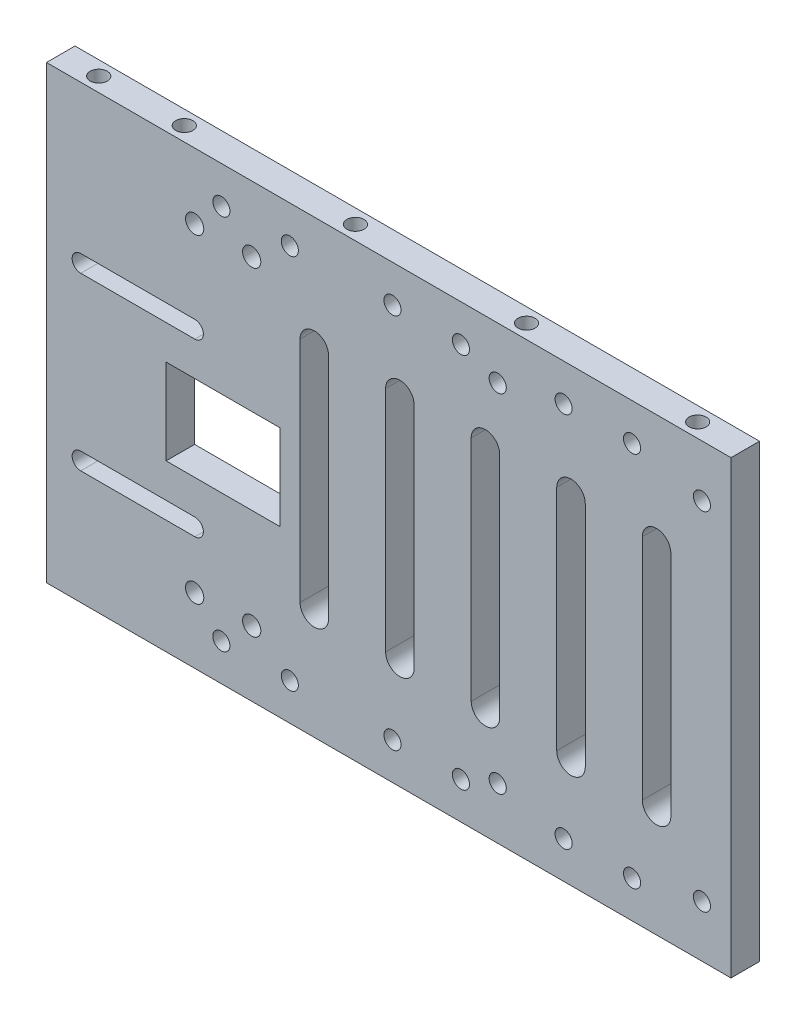
from build123d import *

# Parameters (mm, degrees)
SKETCH_1_W               = 120
SKETCH_1_H               = 79
EXTRUDE_1_DEPTH          = 5
SKETCH_2_R               = 3.1
CUT_EXTRUDE_1_DEPTH      = 2
SKETCH_3_R               = 1.5
CUT_EXTRUDE_2_DEPTH      = 72.897496479
PATTERN_LINEAR_1_COUNT   = 3
PATTERN_LINEAR_1_PITCH   = 30
MIRROR_2_COPY_1_SKETCH_R = 3.1
MIRROR_2_COPY_1_DEPTH    = 2
MIRROR_2_COPY_2_SKETCH_R = 3.1
MIRROR_2_COPY_2_DEPTH    = 2
MIRROR_2_COPY_3_SKETCH_R = 1.5
MIRROR_2_COPY_3_DEPTH    = 72.897496479
MIRROR_2_COPY_4_SKETCH_R = 1.5
MIRROR_2_COPY_4_DEPTH    = 72.897496479
MIRROR_2_COPY_5_SKETCH_R = 3.1
MIRROR_2_COPY_5_DEPTH    = 2
MIRROR_2_COPY_6_SKETCH_R = 1.5
MIRROR_2_COPY_6_DEPTH    = 72.897496479
CUT_EXTRUDE_3_DEPTH      = 1.5
CUT_EXTRUDE_4_DEPTH      = 72.920094549
SKETCH_7_R               = 1.5
CUT_EXTRUDE_6_DEPTH      = 5
SKETCH_9_R               = 1.6
SKETCH_9_R_2             = 1.5
CUT_EXTRUDE_7_DEPTH      = 73.008680032
SKETCH_11_W              = 20
SKETCH_11_H              = 15
CUT_EXTRUDE_8_DEPTH      = 73.008680032


with BuildPart() as part:
    # 草图1 → 凸台-拉伸1 (new body)
    with BuildSketch(Plane.XY):
        Rectangle(SKETCH_1_W, SKETCH_1_H)
    extrude(amount=EXTRUDE_1_DEPTH)

    # 草图2 → 切除-拉伸1 (cut)
    with BuildSketch(Plane(origin=(0, 0, 0), x_dir=(-1, 0, 0), z_dir=(0, 0, -1))):
        with Locations((-42.655984764, -33)):
            Circle(SKETCH_2_R)
        with Locations((-30.655984764, -33)):
            Circle(SKETCH_2_R)
    cut_extrude_1 = extrude(amount=-CUT_EXTRUDE_1_DEPTH, mode=Mode.SUBTRACT)

    # 草图3 → 切除-拉伸2 (cut, through all)
    with BuildSketch(Plane(origin=(0, 0, 2), x_dir=(-1, 0, 0), z_dir=(0, 0, -1))):
        with Locations((-42.655984764, -33)):
            Circle(SKETCH_3_R)
        with Locations((-30.655984764, -33)):
            Circle(SKETCH_3_R)
    cut_extrude_2 = extrude(amount=-CUT_EXTRUDE_2_DEPTH, mode=Mode.SUBTRACT)

    # 阵列(线性)1: 切除-拉伸1, 切除-拉伸2 ×3
    with Locations(*[(-i * PATTERN_LINEAR_1_PITCH, 0, 0) for i in range(1, PATTERN_LINEAR_1_COUNT)]):
        add(cut_extrude_1, mode=Mode.SUBTRACT)
        add(cut_extrude_2, mode=Mode.SUBTRACT)

    # 镜向2 copy 1 sketch → 镜向2 copy 1 (cut)
    with BuildSketch(Plane(origin=(-30, 0, 0), x_dir=(-1, 0, 0), z_dir=(0, 0, -1))):
        with Locations((-42.655984764, 33)):
            Circle(MIRROR_2_COPY_1_SKETCH_R)
        with Locations((-30.655984764, 33)):
            Circle(MIRROR_2_COPY_1_SKETCH_R)
    extrude(amount=-MIRROR_2_COPY_1_DEPTH, mode=Mode.SUBTRACT)

    # 镜向2 copy 2 sketch → 镜向2 copy 2 (cut)
    with BuildSketch(Plane(origin=(-60, 0, 0), x_dir=(-1, 0, 0), z_dir=(0, 0, -1))):
        with Locations((-42.655984764, 33)):
            Circle(MIRROR_2_COPY_2_SKETCH_R)
        with Locations((-30.655984764, 33)):
            Circle(MIRROR_2_COPY_2_SKETCH_R)
    extrude(amount=-MIRROR_2_COPY_2_DEPTH, mode=Mode.SUBTRACT)

    # 镜向2 copy 3 sketch → 镜向2 copy 3 (cut, through all)
    with BuildSketch(Plane(origin=(-30, 0, 2), x_dir=(-1, 0, 0), z_dir=(0, 0, -1))):
        with Locations((-42.655984764, 33)):
            Circle(MIRROR_2_COPY_3_SKETCH_R)
        with Locations((-30.655984764, 33)):
            Circle(MIRROR_2_COPY_3_SKETCH_R)
    extrude(amount=-MIRROR_2_COPY_3_DEPTH, mode=Mode.SUBTRACT)

    # 镜向2 copy 4 sketch → 镜向2 copy 4 (cut, through all)
    with BuildSketch(Plane(origin=(-60, 0, 2), x_dir=(-1, 0, 0), z_dir=(0, 0, -1))):
        with Locations((-42.655984764, 33)):
            Circle(MIRROR_2_COPY_4_SKETCH_R)
        with Locations((-30.655984764, 33)):
            Circle(MIRROR_2_COPY_4_SKETCH_R)
    extrude(amount=-MIRROR_2_COPY_4_DEPTH, mode=Mode.SUBTRACT)

    # 镜向2 copy 5 sketch → 镜向2 copy 5 (cut)
    with BuildSketch(Plane(origin=(0, 0, 0), x_dir=(-1, 0, 0), z_dir=(0, 0, -1))):
        with Locations((-42.655984764, 33)):
            Circle(MIRROR_2_COPY_5_SKETCH_R)
        with Locations((-30.655984764, 33)):
            Circle(MIRROR_2_COPY_5_SKETCH_R)
    extrude(amount=-MIRROR_2_COPY_5_DEPTH, mode=Mode.SUBTRACT)

    # 镜向2 copy 6 sketch → 镜向2 copy 6 (cut, through all)
    with BuildSketch(Plane(origin=(0, 0, 2), x_dir=(-1, 0, 0), z_dir=(0, 0, -1))):
        with Locations((-42.655984764, 33)):
            Circle(MIRROR_2_COPY_6_SKETCH_R)
        with Locations((-30.655984764, 33)):
            Circle(MIRROR_2_COPY_6_SKETCH_R)
    extrude(amount=-MIRROR_2_COPY_6_DEPTH, mode=Mode.SUBTRACT)

    # 草图4 → 切除-拉伸3 (cut)
    with BuildSketch(Plane(origin=(0, 0, 0), x_dir=(-1, 0, 0), z_dir=(0, 0, -1))):
        with BuildLine():
            Line((34, 15.1), (54, 15.1))
            ThreePointArc((54, 15.1), (57.1, 12), (54, 8.9))
            Line((54, 8.9), (34, 8.9))
            ThreePointArc((34, 8.9), (30.9, 12), (34, 15.1))
        make_face()
        with BuildLine():
            Line((34, -21.1), (54, -21.1))
            ThreePointArc((54, -21.1), (57.1, -18), (54, -14.9))
            Line((54, -14.9), (34, -14.9))
            ThreePointArc((34, -14.9), (30.9, -18), (34, -21.1))
        make_face()
    extrude(amount=-CUT_EXTRUDE_3_DEPTH, mode=Mode.SUBTRACT)

    # 草图5 → 切除-拉伸4 (cut, through all)
    with BuildSketch(Plane(origin=(0, 0, 1.5), x_dir=(-1, 0, 0), z_dir=(0, 0, -1))):
        with BuildLine():
            Line((54, 10.5), (34, 10.5))
            ThreePointArc((34, 10.5), (32.5, 12), (34, 13.5))
            Line((34, 13.5), (54, 13.5))
            ThreePointArc((54, 13.5), (55.5, 12), (54, 10.5))
        make_face()
        with BuildLine():
            Line((54, -16.5), (34, -16.5))
            ThreePointArc((34, -16.5), (32.5, -18), (34, -19.5))
            Line((34, -19.5), (54, -19.5))
            ThreePointArc((54, -19.5), (55.5, -18), (54, -16.5))
        make_face()
    extrude(amount=-CUT_EXTRUDE_4_DEPTH, mode=Mode.SUBTRACT)

    # 草图7 → 切除-拉伸6 (cut)
    with BuildSketch(Plane.XZ.offset(39.5)):
        with Locations((51.655984764, 2.5)):
            Circle(SKETCH_7_R)
        with Locations((21.655984764, 2.5)):
            Circle(SKETCH_7_R)
        with Locations((-8.344015236, 2.5)):
            Circle(SKETCH_7_R)
        with Locations((-38.344015236, 2.5)):
            Circle(SKETCH_7_R)
        with Locations((-53.344015236, 2.5)):
            Circle(SKETCH_7_R)
    cut_extrude_6 = extrude(amount=-CUT_EXTRUDE_6_DEPTH, mode=Mode.SUBTRACT)

    # 镜向3: 切除-拉伸6 across plane
    add(cut_extrude_6.mirror(Plane.ZX), mode=Mode.SUBTRACT)

    # 草图9 → 切除-拉伸7 (cut, through all)
    with BuildSketch(Plane(origin=(0, 0, 0), x_dir=(-1, 0, 0), z_dir=(0, 0, -1))):
        with Locations((24.027682272, -28)):
            Circle(SKETCH_9_R)
        with Locations((34.027682272, -28)):
            Circle(SKETCH_9_R)
        with Locations((24.027682272, 28)):
            Circle(SKETCH_9_R)
        with Locations((34.027682272, 28)):
            Circle(SKETCH_9_R)
        with Locations((-19.103783252, 30.4)):
            Circle(SKETCH_9_R_2)
        with Locations((-54.903783252, 30.4)):
            Circle(SKETCH_9_R_2)
        with Locations((-19.103783252, -30.4)):
            Circle(SKETCH_9_R_2)
        with Locations((-54.903783252, -30.4)):
            Circle(SKETCH_9_R_2)
        with BuildLine():
            Line((-49.452559424, -20.266203112), (-49.452559424, 19.733796888))
            ThreePointArc((-49.452559424, 19.733796888), (-46.952559424, 22.233796888), (-44.452559424, 19.733796888))
            Line((-44.452559424, 19.733796888), (-44.452559424, -20.266203112))
            ThreePointArc((-44.452559424, -20.266203112), (-46.952559424, -22.766203112), (-49.452559424, -20.266203112))
        make_face()
        with BuildLine():
            Line((-34.452559424, -20.266203112), (-34.452559424, 19.733796888))
            ThreePointArc((-34.452559424, 19.733796888), (-31.952559424, 22.233796888), (-29.452559424, 19.733796888))
            Line((-29.452559424, 19.733796888), (-29.452559424, -20.266203112))
            ThreePointArc((-29.452559424, -20.266203112), (-31.952559424, -22.766203112), (-34.452559424, -20.266203112))
        make_face()
        with BuildLine():
            Line((-19.452559424, -20.266203112), (-19.452559424, 19.733796888))
            ThreePointArc((-19.452559424, 19.733796888), (-16.952559424, 22.233796888), (-14.452559424, 19.733796888))
            Line((-14.452559424, 19.733796888), (-14.452559424, -20.266203112))
            ThreePointArc((-14.452559424, -20.266203112), (-16.952559424, -22.766203112), (-19.452559424, -20.266203112))
        make_face()
        with BuildLine():
            Line((-4.452559424, -20.266203112), (-4.452559424, 19.733796888))
            ThreePointArc((-4.452559424, 19.733796888), (-1.952559424, 22.233796888), (0.547440576, 19.733796888))
            Line((0.547440576, 19.733796888), (0.547440576, -20.266203112))
            ThreePointArc((0.547440576, -20.266203112), (-1.952559424, -22.766203112), (-4.452559424, -20.266203112))
        make_face()
        with BuildLine():
            Line((10.547440576, -20.266203112), (10.547440576, 19.733796888))
            ThreePointArc((10.547440576, 19.733796888), (13.047440576, 22.233796888), (15.547440576, 19.733796888))
            Line((15.547440576, 19.733796888), (15.547440576, -20.266203112))
            ThreePointArc((15.547440576, -20.266203112), (13.047440576, -22.766203112), (10.547440576, -20.266203112))
        make_face()
    extrude(amount=-CUT_EXTRUDE_7_DEPTH, mode=Mode.SUBTRACT)

    # 草图11 → 切除-拉伸8 (cut, through all)
    with BuildSketch(Plane.XY.offset(5)):
        with Locations((-29.027682272, -3)):
            Rectangle(SKETCH_11_W, SKETCH_11_H)
    extrude(amount=-CUT_EXTRUDE_8_DEPTH, mode=Mode.SUBTRACT)


solid = part.part
